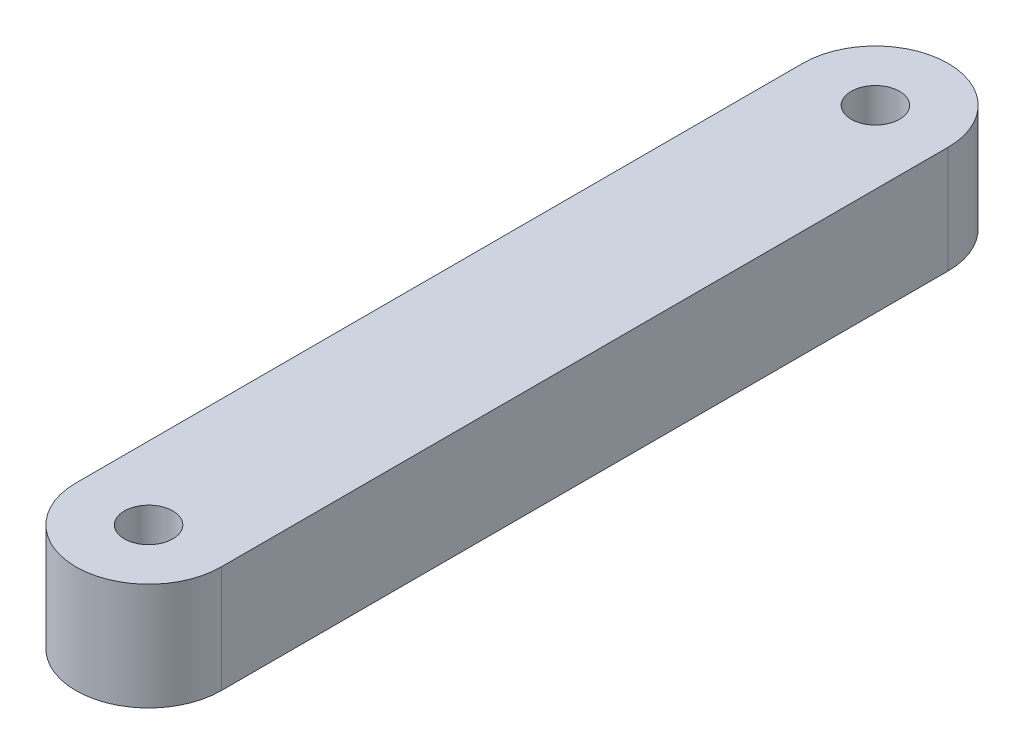
from build123d import *

# Parameters (mm, degrees)
SKETCH1_R           = 4
BOSS_EXTRUDE1_DEPTH = 17.7


with BuildPart() as part:
    # Sketch1 → Boss-Extrude1 (new body)
    with BuildSketch(Plane(origin=(0, 0, 0), x_dir=(1, 0, 0), z_dir=(0, 1, 0))):
        with BuildLine():
            Line((-12, -60), (-12, 60))
            ThreePointArc((-12, 60), (0, 72), (12, 60))
            Line((12, 60), (12, -60))
            ThreePointArc((12, -60), (0, -72), (-12, -60))
        make_face()
        with Locations((0, 60)):
            Circle(SKETCH1_R, mode=Mode.SUBTRACT)
        with Locations((0, -60)):
            Circle(SKETCH1_R, mode=Mode.SUBTRACT)
    extrude(amount=BOSS_EXTRUDE1_DEPTH)


solid = part.part
